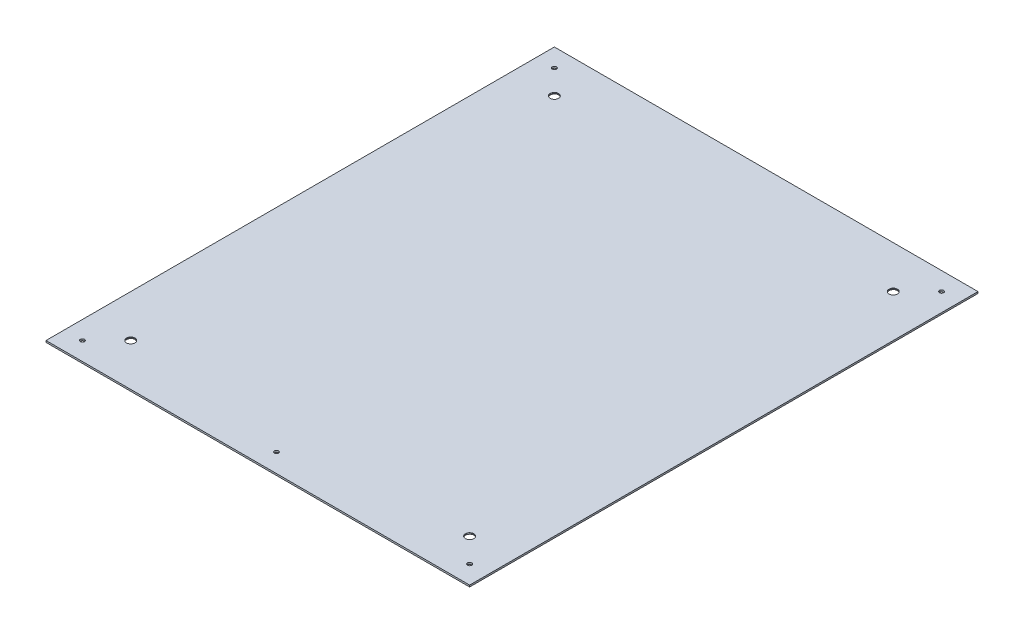
from build123d import *
from build123d.topology import SkipClean

# Parameters (mm, degrees)
SKETCH1_W          = 500
SKETCH1_H          = 600
SKETCH1_R          = 2.5
BASE_FLANGE1_DEPTH = 2
SKETCH3_R          = 5
CUT_EXTRUDE2_DEPTH = 391.517605237
THREAD1_PITCH      = 1.25
THREAD2_PITCH      = 1.25
THREAD3_PITCH      = 1.25
THREAD4_PITCH      = 1.25
SKETCH6_R          = 2.463026371
CUT_EXTRUDE4_DEPTH = 10


# Sheet-metal steps are written as plain solids
with BuildPart() as part:
    # Sketch1 → Base-Flange1 (new body)
    with BuildSketch(Plane(origin=(0, 0, 0), x_dir=(1, 0, 0), z_dir=(0, 1, 0))):
        Rectangle(SKETCH1_W, SKETCH1_H)
        with Locations(Location((-228.5, 278.5, 0), (0, 0, 270))):
            Circle(SKETCH1_R, mode=Mode.SUBTRACT)
        with Locations(Location((228.5, 278.5, 0), (0, 0, 270))):
            Circle(SKETCH1_R, mode=Mode.SUBTRACT)
        with Locations(Location((228.5, -278.5, 0), (0, 0, 270))):
            Circle(SKETCH1_R, mode=Mode.SUBTRACT)
        with Locations(Location((-228.5, -278.5, 0), (0, 0, 270))):
            Circle(SKETCH1_R, mode=Mode.SUBTRACT)
    extrude(amount=-BASE_FLANGE1_DEPTH)

    # Sketch3 → Cut-Extrude2 (cut, through all)
    with BuildSketch(Plane(origin=(0, 0, 0), x_dir=(1, 0, 0), z_dir=(0, 1, 0))):
        with Locations(Location((-200, 250, 0), (0, 0, 270))):
            Circle(SKETCH3_R)
        with Locations(Location((200, 250, 0), (0, 0, 90))):
            Circle(SKETCH3_R)
        with Locations(Location((-200, -250, 0), (0, 0, 90))):
            Circle(SKETCH3_R)
        with Locations(Location((200, -250, 0), (0, 0, 270))):
            Circle(SKETCH3_R)
    extrude(amount=-CUT_EXTRUDE2_DEPTH, mode=Mode.SUBTRACT)

    # Thread1: the profile of Thread Profile1 profile screwed along a right-hand helix of 1.6 turns, 8 arcs to a turn; built about Z, then put on its axis
    with SkipClean():  # the faces are left unmerged after this step: merging them gives an invalid solid
        thread1_z = Axis((0, 0, 0), (0, 0, 1))
        thread1_corners = [(4.9997, 0, -0.000173205), (5.676582344, 0, 0.390624998), (5.676582344, 0, 0.546874998), (4.9997, 0, 0.937673202)]
        with BuildLine(mode=Mode.PRIVATE) as thread1_profile:
            Line(thread1_corners[0], thread1_corners[1])
            Line(thread1_corners[1], thread1_corners[2])
            Line(thread1_corners[2], thread1_corners[3])
            Line(thread1_corners[3], thread1_corners[0])
        thread1_cap = Face(thread1_profile.wire())
        thread1_turn_angles = [0, 22.5, 45, 67.5, 90, 112.5, 135, 157.5, 180, 202.5, 225, 247.5, 270, 292.5, 315, 337.5, 360]
        thread1_turn_weights = [1, 0.9238795325112867, 1, 0.9238795325112867, 1, 0.9238795325112867, 1, 0.9238795325112867, 1, 0.9238795325112867, 1, 0.9238795325112867, 1, 0.9238795325112867, 1, 0.9238795325112867, 1]
        thread1_turn_rails = [Edge.make_bspline([Vector(p[0], p[1], 0).rotate(thread1_z, thread1_turn_angles[k]) / thread1_turn_weights[k] + Vector(0, 0, p[2] + THREAD1_PITCH * thread1_turn_angles[k] / 360) for k in range(17)], [0, 0, 0, 1, 1, 2, 2, 3, 3, 4, 4, 5, 5, 6, 6, 7, 7, 8, 8, 8], 2, thread1_turn_weights) for p in thread1_corners]
        thread1_turn_sides = [Face.make_surface_from_curves(thread1_turn_rails[p[0]], thread1_turn_rails[p[1]]) for p in [(0, 1), (1, 2), (2, 3), (3, 0)]]
        thread1_last_angles = [360, 382.5, 405, 427.5, 450, 472.5, 495, 517.5, 540, 558, 576]
        thread1_last_weights = [1, 0.9238795325112867, 1, 0.9238795325112867, 1, 0.9238795325112867, 1, 0.9238795325112867, 1, 0.9510565162951535, 1]
        thread1_last_rails = [Edge.make_bspline([Vector(p[0], p[1], 0).rotate(thread1_z, thread1_last_angles[k]) / thread1_last_weights[k] + Vector(0, 0, p[2] + THREAD1_PITCH * thread1_last_angles[k] / 360) for k in range(11)], [0, 0, 0, 1, 1, 2, 2, 3, 3, 4, 4, 5, 5, 5], 2, thread1_last_weights) for p in thread1_corners]
        thread1_last_sides = [Face.make_surface_from_curves(thread1_last_rails[p[0]], thread1_last_rails[p[1]]) for p in [(0, 1), (1, 2), (2, 3), (3, 0)]]
        thread1 = Plane(origin=(-200, 0, -250), x_dir=(-1, 0, 0), z_dir=(0, -1, 0)) * Solid(Shell([*thread1_turn_sides, *thread1_last_sides, thread1_cap, thread1_cap.rotate(thread1_z, 576).moved(Location((0, 0, THREAD1_PITCH * 576 / 360)))]))
        add(thread1, mode=Mode.SUBTRACT)

    # Thread2: the profile of Thread Profile2 profile screwed along a right-hand helix of 1.6 turns, 8 arcs to a turn; built about Z, then put on its axis
    with SkipClean():  # the faces are left unmerged after this step: merging them gives an invalid solid
        thread2_z = Axis((0, 0, 0), (0, 0, 1))
        thread2_corners = [(4.9997, 0, -0.000173205), (5.676582344, 0, 0.390624998), (5.676582344, 0, 0.546874998), (4.9997, 0, 0.937673202)]
        with BuildLine(mode=Mode.PRIVATE) as thread2_profile:
            Line(thread2_corners[0], thread2_corners[1])
            Line(thread2_corners[1], thread2_corners[2])
            Line(thread2_corners[2], thread2_corners[3])
            Line(thread2_corners[3], thread2_corners[0])
        thread2_cap = Face(thread2_profile.wire())
        thread2_turn_angles = [0, 22.5, 45, 67.5, 90, 112.5, 135, 157.5, 180, 202.5, 225, 247.5, 270, 292.5, 315, 337.5, 360]
        thread2_turn_weights = [1, 0.9238795325112867, 1, 0.9238795325112867, 1, 0.9238795325112867, 1, 0.9238795325112867, 1, 0.9238795325112867, 1, 0.9238795325112867, 1, 0.9238795325112867, 1, 0.9238795325112867, 1]
        thread2_turn_rails = [Edge.make_bspline([Vector(p[0], p[1], 0).rotate(thread2_z, thread2_turn_angles[k]) / thread2_turn_weights[k] + Vector(0, 0, p[2] + THREAD2_PITCH * thread2_turn_angles[k] / 360) for k in range(17)], [0, 0, 0, 1, 1, 2, 2, 3, 3, 4, 4, 5, 5, 6, 6, 7, 7, 8, 8, 8], 2, thread2_turn_weights) for p in thread2_corners]
        thread2_turn_sides = [Face.make_surface_from_curves(thread2_turn_rails[p[0]], thread2_turn_rails[p[1]]) for p in [(0, 1), (1, 2), (2, 3), (3, 0)]]
        thread2_last_angles = [360, 382.5, 405, 427.5, 450, 472.5, 495, 517.5, 540, 558, 576]
        thread2_last_weights = [1, 0.9238795325112867, 1, 0.9238795325112867, 1, 0.9238795325112867, 1, 0.9238795325112867, 1, 0.9510565162951535, 1]
        thread2_last_rails = [Edge.make_bspline([Vector(p[0], p[1], 0).rotate(thread2_z, thread2_last_angles[k]) / thread2_last_weights[k] + Vector(0, 0, p[2] + THREAD2_PITCH * thread2_last_angles[k] / 360) for k in range(11)], [0, 0, 0, 1, 1, 2, 2, 3, 3, 4, 4, 5, 5, 5], 2, thread2_last_weights) for p in thread2_corners]
        thread2_last_sides = [Face.make_surface_from_curves(thread2_last_rails[p[0]], thread2_last_rails[p[1]]) for p in [(0, 1), (1, 2), (2, 3), (3, 0)]]
        thread2 = Plane(origin=(-200, 0, 250), x_dir=(-1, 0, 0), z_dir=(0, -1, 0)) * Solid(Shell([*thread2_turn_sides, *thread2_last_sides, thread2_cap, thread2_cap.rotate(thread2_z, 576).moved(Location((0, 0, THREAD2_PITCH * 576 / 360)))]))
        add(thread2, mode=Mode.SUBTRACT)

    # Thread3: the profile of Thread Profile3 profile screwed along a right-hand helix of 1.6 turns, 8 arcs to a turn; built about Z, then put on its axis
    with SkipClean():  # the faces are left unmerged after this step: merging them gives an invalid solid
        thread3_z = Axis((0, 0, 0), (0, 0, 1))
        thread3_corners = [(4.9997, 0, -0.000173205), (5.676582344, 0, 0.390624998), (5.676582344, 0, 0.546874998), (4.9997, 0, 0.937673202)]
        with BuildLine(mode=Mode.PRIVATE) as thread3_profile:
            Line(thread3_corners[0], thread3_corners[1])
            Line(thread3_corners[1], thread3_corners[2])
            Line(thread3_corners[2], thread3_corners[3])
            Line(thread3_corners[3], thread3_corners[0])
        thread3_cap = Face(thread3_profile.wire())
        thread3_turn_angles = [0, 22.5, 45, 67.5, 90, 112.5, 135, 157.5, 180, 202.5, 225, 247.5, 270, 292.5, 315, 337.5, 360]
        thread3_turn_weights = [1, 0.9238795325112867, 1, 0.9238795325112867, 1, 0.9238795325112867, 1, 0.9238795325112867, 1, 0.9238795325112867, 1, 0.9238795325112867, 1, 0.9238795325112867, 1, 0.9238795325112867, 1]
        thread3_turn_rails = [Edge.make_bspline([Vector(p[0], p[1], 0).rotate(thread3_z, thread3_turn_angles[k]) / thread3_turn_weights[k] + Vector(0, 0, p[2] + THREAD3_PITCH * thread3_turn_angles[k] / 360) for k in range(17)], [0, 0, 0, 1, 1, 2, 2, 3, 3, 4, 4, 5, 5, 6, 6, 7, 7, 8, 8, 8], 2, thread3_turn_weights) for p in thread3_corners]
        thread3_turn_sides = [Face.make_surface_from_curves(thread3_turn_rails[p[0]], thread3_turn_rails[p[1]]) for p in [(0, 1), (1, 2), (2, 3), (3, 0)]]
        thread3_last_angles = [360, 382.5, 405, 427.5, 450, 472.5, 495, 517.5, 540, 558, 576]
        thread3_last_weights = [1, 0.9238795325112867, 1, 0.9238795325112867, 1, 0.9238795325112867, 1, 0.9238795325112867, 1, 0.9510565162951535, 1]
        thread3_last_rails = [Edge.make_bspline([Vector(p[0], p[1], 0).rotate(thread3_z, thread3_last_angles[k]) / thread3_last_weights[k] + Vector(0, 0, p[2] + THREAD3_PITCH * thread3_last_angles[k] / 360) for k in range(11)], [0, 0, 0, 1, 1, 2, 2, 3, 3, 4, 4, 5, 5, 5], 2, thread3_last_weights) for p in thread3_corners]
        thread3_last_sides = [Face.make_surface_from_curves(thread3_last_rails[p[0]], thread3_last_rails[p[1]]) for p in [(0, 1), (1, 2), (2, 3), (3, 0)]]
        thread3 = Plane(origin=(200, 0, -250), x_dir=(-1, 0, 0), z_dir=(0, -1, 0)) * Solid(Shell([*thread3_turn_sides, *thread3_last_sides, thread3_cap, thread3_cap.rotate(thread3_z, 576).moved(Location((0, 0, THREAD3_PITCH * 576 / 360)))]))
        add(thread3, mode=Mode.SUBTRACT)

    # Thread4: the profile of Thread Profile4 profile screwed along a right-hand helix of 1.6 turns, 8 arcs to a turn; built about Z, then put on its axis
    with SkipClean():  # the faces are left unmerged after this step: merging them gives an invalid solid
        thread4_z = Axis((0, 0, 0), (0, 0, 1))
        thread4_corners = [(4.9997, 0, -0.000173205), (5.676582344, 0, 0.390624998), (5.676582344, 0, 0.546874998), (4.9997, 0, 0.937673202)]
        with BuildLine(mode=Mode.PRIVATE) as thread4_profile:
            Line(thread4_corners[0], thread4_corners[1])
            Line(thread4_corners[1], thread4_corners[2])
            Line(thread4_corners[2], thread4_corners[3])
            Line(thread4_corners[3], thread4_corners[0])
        thread4_cap = Face(thread4_profile.wire())
        thread4_turn_angles = [0, 22.5, 45, 67.5, 90, 112.5, 135, 157.5, 180, 202.5, 225, 247.5, 270, 292.5, 315, 337.5, 360]
        thread4_turn_weights = [1, 0.9238795325112867, 1, 0.9238795325112867, 1, 0.9238795325112867, 1, 0.9238795325112867, 1, 0.9238795325112867, 1, 0.9238795325112867, 1, 0.9238795325112867, 1, 0.9238795325112867, 1]
        thread4_turn_rails = [Edge.make_bspline([Vector(p[0], p[1], 0).rotate(thread4_z, thread4_turn_angles[k]) / thread4_turn_weights[k] + Vector(0, 0, p[2] + THREAD4_PITCH * thread4_turn_angles[k] / 360) for k in range(17)], [0, 0, 0, 1, 1, 2, 2, 3, 3, 4, 4, 5, 5, 6, 6, 7, 7, 8, 8, 8], 2, thread4_turn_weights) for p in thread4_corners]
        thread4_turn_sides = [Face.make_surface_from_curves(thread4_turn_rails[p[0]], thread4_turn_rails[p[1]]) for p in [(0, 1), (1, 2), (2, 3), (3, 0)]]
        thread4_last_angles = [360, 382.5, 405, 427.5, 450, 472.5, 495, 517.5, 540, 558, 576]
        thread4_last_weights = [1, 0.9238795325112867, 1, 0.9238795325112867, 1, 0.9238795325112867, 1, 0.9238795325112867, 1, 0.9510565162951535, 1]
        thread4_last_rails = [Edge.make_bspline([Vector(p[0], p[1], 0).rotate(thread4_z, thread4_last_angles[k]) / thread4_last_weights[k] + Vector(0, 0, p[2] + THREAD4_PITCH * thread4_last_angles[k] / 360) for k in range(11)], [0, 0, 0, 1, 1, 2, 2, 3, 3, 4, 4, 5, 5, 5], 2, thread4_last_weights) for p in thread4_corners]
        thread4_last_sides = [Face.make_surface_from_curves(thread4_last_rails[p[0]], thread4_last_rails[p[1]]) for p in [(0, 1), (1, 2), (2, 3), (3, 0)]]
        thread4 = Plane(origin=(200, 0, 250), x_dir=(-1, 0, 0), z_dir=(0, -1, 0)) * Solid(Shell([*thread4_turn_sides, *thread4_last_sides, thread4_cap, thread4_cap.rotate(thread4_z, 576).moved(Location((0, 0, THREAD4_PITCH * 576 / 360)))]))
        add(thread4, mode=Mode.SUBTRACT)

    # Sketch6 → Cut-Extrude4 (cut)
    with SkipClean():  # the faces are left unmerged after this step: merging them gives an invalid solid
        with BuildSketch(Plane(origin=(0, 0, 0), x_dir=(1, 0, 0), z_dir=(0, 1, 0))):
            with Locations(Location((0, -278, 0), (0, 0, 270))):
                Circle(SKETCH6_R)
        extrude(amount=-CUT_EXTRUDE4_DEPTH, mode=Mode.SUBTRACT)


solid = part.part
